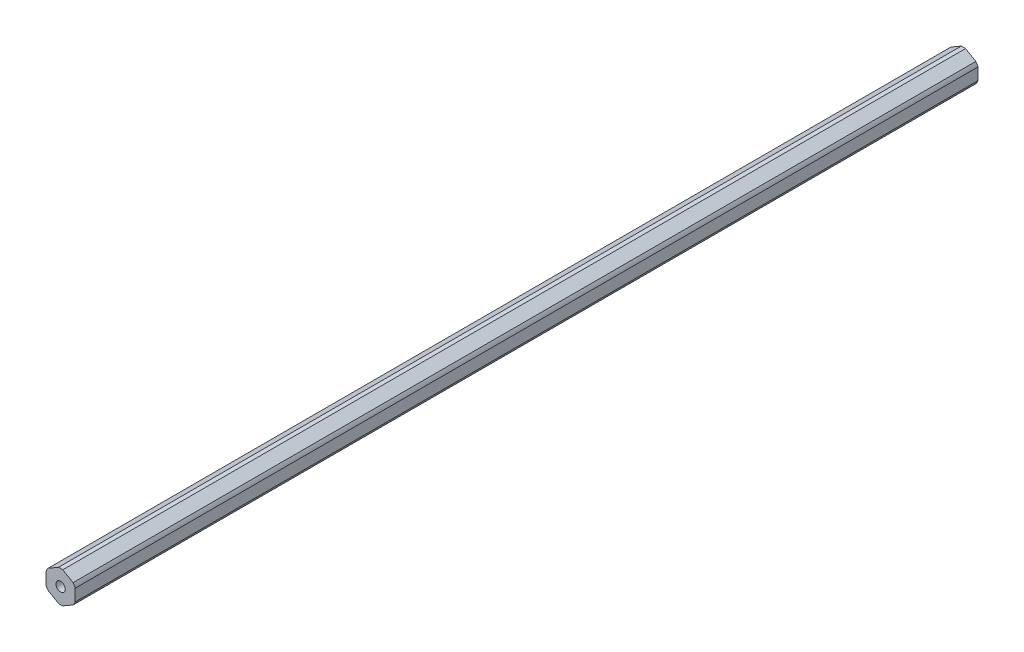
from build123d import *

# Parameters (mm, degrees)
BOSS_EXTRUDE1_DEPTH = 196.1515
SKETCH2_R           = 2.0193
CUT_EXTRUDE1_DEPTH  = 393.414319913


with BuildPart() as part:
    # Sketch1 → Boss-Extrude1 (new, symmetric)
    with BuildSketch(Plane.XY):
        with BuildLine():
            ThreePointArc((0.93173274, 6.79441227), (0, 6.858), (-0.93173274, 6.79441227))
            Line((-0.93173274, 6.79441227), (-5.41826726, 4.204110358))
            ThreePointArc((-5.41826726, 4.204110358), (-5.939202219, 3.429), (-6.35, 2.590301913))
            Line((-6.35, 2.590301913), (-6.35, -2.590301913))
            ThreePointArc((-6.35, -2.590301913), (-5.939202219, -3.429), (-5.41826726, -4.204110358))
            Line((-5.41826726, -4.204110358), (-0.93173274, -6.79441227))
            ThreePointArc((-0.93173274, -6.79441227), (0, -6.858), (0.93173274, -6.79441227))
            Line((0.93173274, -6.79441227), (5.41826726, -4.204110358))
            ThreePointArc((5.41826726, -4.204110358), (5.939202219, -3.429), (6.35, -2.590301913))
            Line((6.35, -2.590301913), (6.35, 2.590301913))
            ThreePointArc((6.35, 2.590301913), (5.939202219, 3.429), (5.41826726, 4.204110358))
            Line((5.41826726, 4.204110358), (0.93173274, 6.79441227))
        make_face()
    extrude(amount=BOSS_EXTRUDE1_DEPTH, both=True)

    # Sketch2 → Cut-Extrude1 (cut, through all)
    with BuildSketch(Plane.XY.offset(196.1515)):
        Circle(SKETCH2_R)
    extrude(amount=-CUT_EXTRUDE1_DEPTH, mode=Mode.SUBTRACT)


solid = part.part
